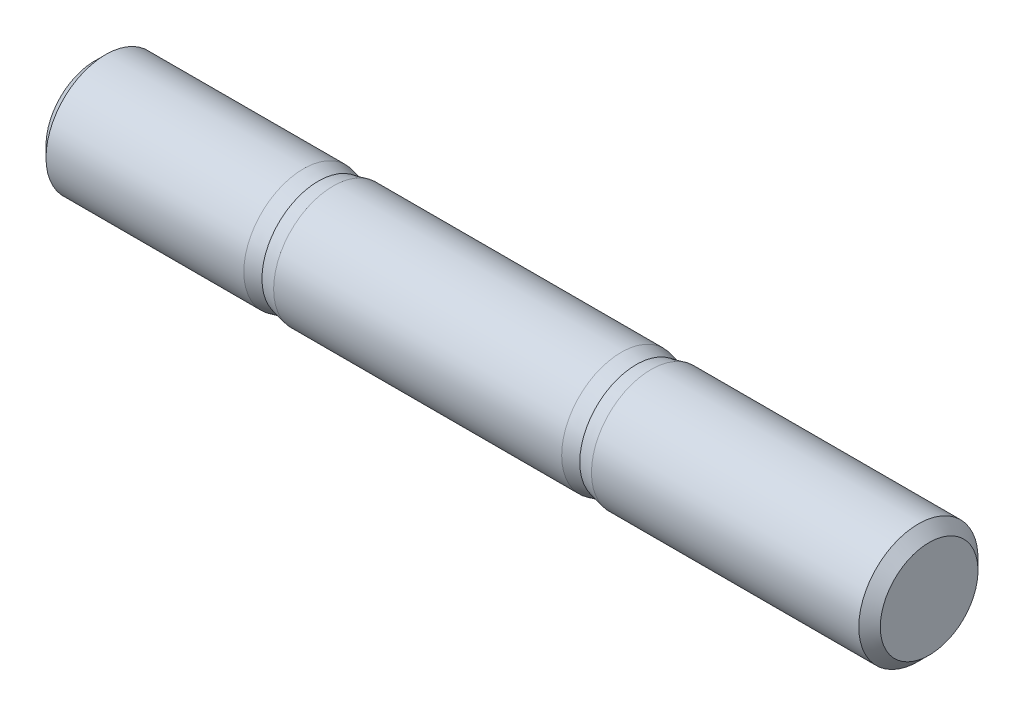
from build123d import *

# Parameters (mm, degrees)
HEADCHAMFER_SIZE = 0.5415


with BuildPart() as part:
    # Sketch1 → BaseHead (revolve)
    with BuildSketch(Plane.XY):
        Polygon((0, 0), (0, 3), (10.5, 3), (12, 2.675), (26.5, 2.675), (28, 3), (42, 3), (42, 0), align=None)
    revolve(axis=Axis((-1.310841664, 0, 0), (1, 0, 0)))

    # HeadChamfer
    headchamfer_edges = [part.edges().sort_by_distance(p)[0] for p in [
        (42, -3, 0),
        (0, -3, 0),
    ]]
    chamfer(headchamfer_edges, length=HEADCHAMFER_SIZE)

    # Sketch2 → BaseBody (revolve)
    with BuildSketch(Plane.XY):
        Polygon((10.5, 2.675), (12, 3), (26.5, 3), (28, 2.675), align=None)
    revolve(axis=Axis((-1.310841664, 0, 0), (1, 0, 0)))


solid = part.part
